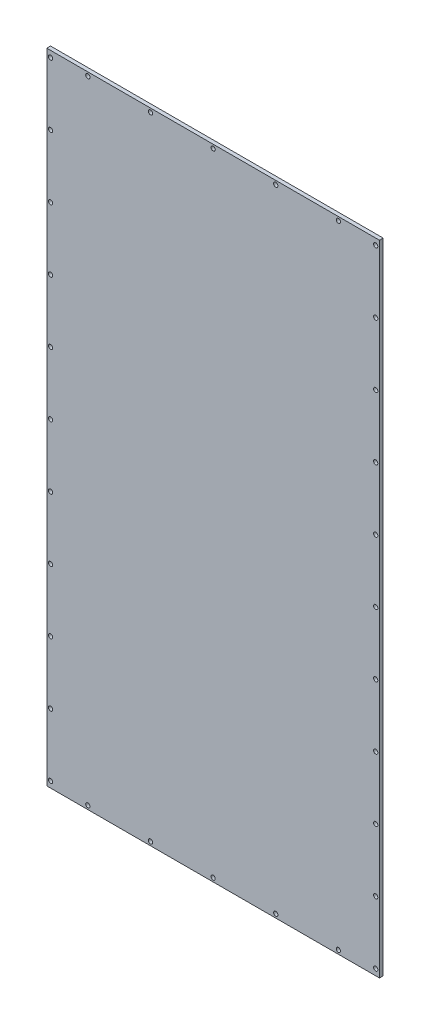
from build123d import *

# Parameters (mm, degrees)
SKETCH1_W            = 265.54
SKETCH1_H            = 510
BOSS_EXTRUDE1_DEPTH  = 2.9972
M3_CLEARANCE_HOLE1_D = 3.4
M3_CLEARANCE_HOLE2_D = 3.4
LPATTERN1_COUNT      = 6
LPATTERN1_PITCH      = 50
LPATTERN1_COL_COUNT  = 6
LPATTERN1_COL_PITCH  = 50
LPATTERN2_COUNT      = 3
LPATTERN2_PITCH      = 50
LPATTERN2_COL_COUNT  = 3
LPATTERN2_COL_PITCH  = 50
MIRROR1_COPY_1_D     = 3.4
MIRROR1_COPY_2_D     = 3.4
MIRROR1_COPY_3_D     = 3.4
MIRROR1_COPY_4_D     = 3.4
MIRROR1_COPY_5_D     = 3.4
MIRROR1_COPY_6_D     = 3.4
MIRROR1_COPY_7_D     = 3.4
MIRROR1_COPY_8_D     = 3.4
MIRROR1_COPY_9_D     = 3.4
MIRROR1_COPY_10_D    = 3.4
MIRROR2_COPY_1_D     = 3.4
MIRROR2_COPY_2_D     = 3.4
MIRROR2_COPY_3_D     = 3.4
MIRROR2_COPY_4_D     = 3.4


with BuildPart() as part:
    # Sketch1 → Boss-Extrude1 (new body)
    with BuildSketch(Plane.XY):
        with Locations((132.77, 255)):
            Rectangle(SKETCH1_W, SKETCH1_H)
    extrude(amount=BOSS_EXTRUDE1_DEPTH)

    # M3 Clearance Hole1 (through all)
    with Locations(Plane.XY.offset(2.9972)):
        with Locations((262.54, 255)):
            m3_clearance_hole1 = Hole(M3_CLEARANCE_HOLE1_D / 2)

    # M3 Clearance Hole2 (through all)
    with Locations(Plane.XY.offset(2.9972)):
        with Locations((132.77, 507)):
            m3_clearance_hole2 = Hole(M3_CLEARANCE_HOLE2_D / 2)

    # LPattern1: M3 Clearance Hole1 ×6
    with Locations(*[(0, -i * LPATTERN1_PITCH, 0) for i in range(1, LPATTERN1_COUNT)]):
        add(m3_clearance_hole1, mode=Mode.SUBTRACT)

    # LPattern1 col: M3 Clearance Hole1 ×6
    with Locations(*[(0, i * LPATTERN1_COL_PITCH, 0) for i in range(1, LPATTERN1_COL_COUNT)]):
        add(m3_clearance_hole1, mode=Mode.SUBTRACT)

    # LPattern2: M3 Clearance Hole2 ×3
    with Locations(*[(i * LPATTERN2_PITCH, 0, 0) for i in range(1, LPATTERN2_COUNT)]):
        add(m3_clearance_hole2, mode=Mode.SUBTRACT)

    # LPattern2 col: M3 Clearance Hole2 ×3
    with Locations(*[(-i * LPATTERN2_COL_PITCH, 0, 0) for i in range(1, LPATTERN2_COL_COUNT)]):
        add(m3_clearance_hole2, mode=Mode.SUBTRACT)

    # Mirror1: M3 Clearance Hole1 across plane
    add(m3_clearance_hole1.mirror(Plane.ZY.offset(-132.77)), mode=Mode.SUBTRACT)

    # Mirror1 copy 1 (through all)
    with Locations(Plane(origin=(265.54, -50, 2.9972), x_dir=(-1, 0, 0), z_dir=(0, 0, 1))):
        with Locations((262.54, -255)):
            Hole(MIRROR1_COPY_1_D / 2)

    # Mirror1 copy 2 (through all)
    with Locations(Plane(origin=(265.54, -100, 2.9972), x_dir=(-1, 0, 0), z_dir=(0, 0, 1))):
        with Locations((262.54, -255)):
            Hole(MIRROR1_COPY_2_D / 2)

    # Mirror1 copy 3 (through all)
    with Locations(Plane(origin=(265.54, -150, 2.9972), x_dir=(-1, 0, 0), z_dir=(0, 0, 1))):
        with Locations((262.54, -255)):
            Hole(MIRROR1_COPY_3_D / 2)

    # Mirror1 copy 4 (through all)
    with Locations(Plane(origin=(265.54, -200, 2.9972), x_dir=(-1, 0, 0), z_dir=(0, 0, 1))):
        with Locations((262.54, -255)):
            Hole(MIRROR1_COPY_4_D / 2)

    # Mirror1 copy 5 (through all)
    with Locations(Plane(origin=(265.54, -250, 2.9972), x_dir=(-1, 0, 0), z_dir=(0, 0, 1))):
        with Locations((262.54, -255)):
            Hole(MIRROR1_COPY_5_D / 2)

    # Mirror1 copy 6 (through all)
    with Locations(Plane(origin=(265.54, 50, 2.9972), x_dir=(-1, 0, 0), z_dir=(0, 0, 1))):
        with Locations((262.54, -255)):
            Hole(MIRROR1_COPY_6_D / 2)

    # Mirror1 copy 7 (through all)
    with Locations(Plane(origin=(265.54, 100, 2.9972), x_dir=(-1, 0, 0), z_dir=(0, 0, 1))):
        with Locations((262.54, -255)):
            Hole(MIRROR1_COPY_7_D / 2)

    # Mirror1 copy 8 (through all)
    with Locations(Plane(origin=(265.54, 150, 2.9972), x_dir=(-1, 0, 0), z_dir=(0, 0, 1))):
        with Locations((262.54, -255)):
            Hole(MIRROR1_COPY_8_D / 2)

    # Mirror1 copy 9 (through all)
    with Locations(Plane(origin=(265.54, 200, 2.9972), x_dir=(-1, 0, 0), z_dir=(0, 0, 1))):
        with Locations((262.54, -255)):
            Hole(MIRROR1_COPY_9_D / 2)

    # Mirror1 copy 10 (through all)
    with Locations(Plane(origin=(265.54, 250, 2.9972), x_dir=(-1, 0, 0), z_dir=(0, 0, 1))):
        with Locations((262.54, -255)):
            Hole(MIRROR1_COPY_10_D / 2)

    # Mirror2: M3 Clearance Hole2 across plane
    add(m3_clearance_hole2.mirror(Plane.ZX.offset(255)), mode=Mode.SUBTRACT)

    # Mirror2 copy 1 (through all)
    with Locations(Plane(origin=(50, 510, 2.9972), x_dir=(1, 0, 0), z_dir=(0, 0, 1))):
        with Locations((132.77, -507)):
            Hole(MIRROR2_COPY_1_D / 2)

    # Mirror2 copy 2 (through all)
    with Locations(Plane(origin=(100, 510, 2.9972), x_dir=(1, 0, 0), z_dir=(0, 0, 1))):
        with Locations((132.77, -507)):
            Hole(MIRROR2_COPY_2_D / 2)

    # Mirror2 copy 3 (through all)
    with Locations(Plane(origin=(-50, 510, 2.9972), x_dir=(1, 0, 0), z_dir=(0, 0, 1))):
        with Locations((132.77, -507)):
            Hole(MIRROR2_COPY_3_D / 2)

    # Mirror2 copy 4 (through all)
    with Locations(Plane(origin=(-100, 510, 2.9972), x_dir=(1, 0, 0), z_dir=(0, 0, 1))):
        with Locations((132.77, -507)):
            Hole(MIRROR2_COPY_4_D / 2)


solid = part.part
